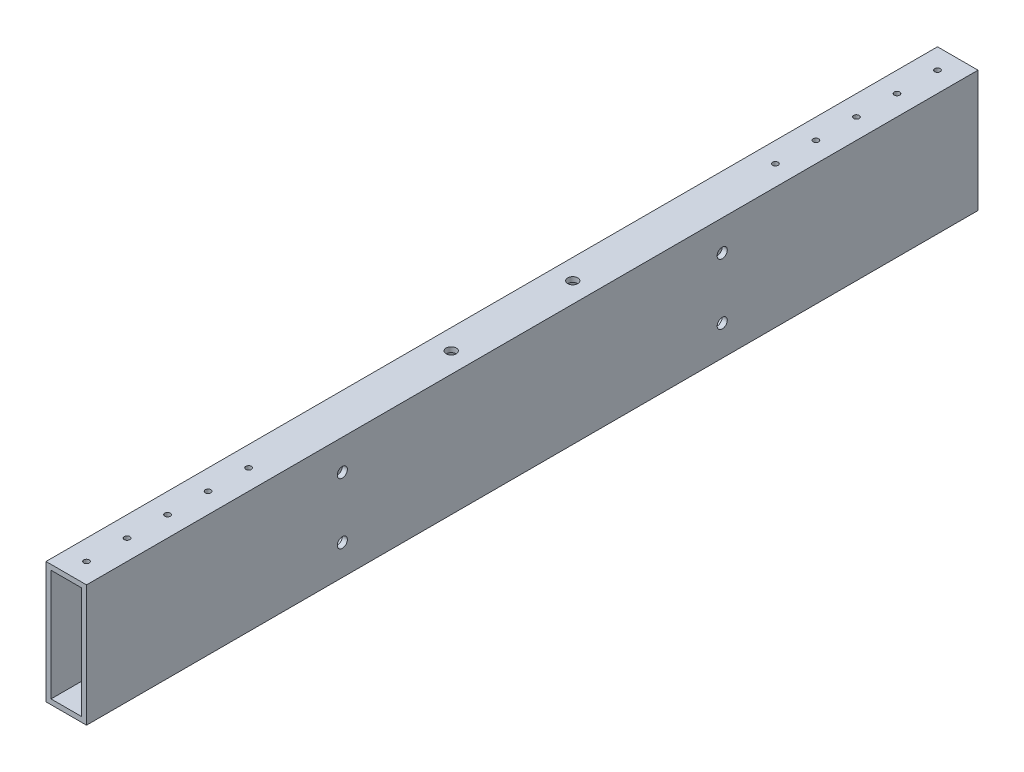
from build123d import *

# Parameters (mm, degrees)
SKETCH1_W                       = 25.4
SKETCH1_H                       = 76.2
SKETCH1_W_2                     = 19.05
SKETCH1_H_2                     = 69.85
BOSS_EXTRUDE1_DEPTH             = 279.4
SKETCH3_R                       = 1.7272
CUT_EXTRUDE2_DEPTH              = 6.35
F_1_4_0_25_DIAMETER_HOLE1_D     = 6.35
F_1_4_0_25_DIAMETER_HOLE1_DEPTH = 25.4
F_1_4_0_25_DIAMETER_HOLE1_TIP   = 1.907732465
F_1_4_0_25_DIAMETER_HOLE2_D     = 6.35
SKETCH2_R                       = 1.7272
CUT_EXTRUDE4_DEPTH              = 6.35


with BuildPart() as part:
    # Sketch1 → Boss-Extrude1 (new, symmetric)
    with BuildSketch(Plane.XY):
        Rectangle(SKETCH1_W, SKETCH1_H)
        Rectangle(SKETCH1_W_2, SKETCH1_H_2, mode=Mode.SUBTRACT)
    extrude(amount=BOSS_EXTRUDE1_DEPTH, both=True)

    # Sketch3 → Cut-Extrude2 (cut)
    with BuildSketch(Plane.XZ.offset(38.1)):
        with Locations((0, 254)):
            Circle(SKETCH3_R)
        with Locations((0, 203.2)):
            Circle(SKETCH3_R)
        with Locations((0, 152.4)):
            Circle(SKETCH3_R)
        with Locations((0, 101.6)):
            Circle(SKETCH3_R)
        with Locations((0, 50.8)):
            Circle(SKETCH3_R)
        Circle(SKETCH3_R)
        with Locations((0, -50.8)):
            Circle(SKETCH3_R)
        with Locations((0, -101.6)):
            Circle(SKETCH3_R)
        with Locations((0, -152.4)):
            Circle(SKETCH3_R)
        with Locations((0, -203.2)):
            Circle(SKETCH3_R)
        with Locations((0, -254)):
            Circle(SKETCH3_R)
    extrude(amount=-CUT_EXTRUDE2_DEPTH, mode=Mode.SUBTRACT)

    # 1/4 (0.25) Diameter Hole1
    with Locations(Plane.ZY.offset(12.7)):
        with Locations((-119.0625, -19.05), (119.0625, -19.05), (-119.0625, 19.05), (119.0625, 19.05)):
            Hole(F_1_4_0_25_DIAMETER_HOLE1_D / 2, depth=F_1_4_0_25_DIAMETER_HOLE1_DEPTH)
            with Locations((0, 0, -(F_1_4_0_25_DIAMETER_HOLE1_DEPTH + F_1_4_0_25_DIAMETER_HOLE1_TIP / 2))):  # 118° drill point
                Cone(0, F_1_4_0_25_DIAMETER_HOLE1_D / 2, F_1_4_0_25_DIAMETER_HOLE1_TIP, mode=Mode.SUBTRACT)

    # 1/4 (0.25) Diameter Hole2 (through all)
    with Locations(Plane(origin=(0, 38.1, 0), x_dir=(1, 0, 0), z_dir=(0, 1, 0))):
        with Locations((0, -38.1), (0, 38.1)):
            Hole(F_1_4_0_25_DIAMETER_HOLE2_D / 2)

    # Sketch2 → Cut-Extrude4 (cut)
    with BuildSketch(Plane(origin=(0, 38.1, 0), x_dir=(1, 0, 0), z_dir=(0, 1, 0))):
        with Locations((0, 266.7)):
            Circle(SKETCH2_R)
        with Locations((0, 241.3)):
            Circle(SKETCH2_R)
        with Locations((0, 215.9)):
            Circle(SKETCH2_R)
        with Locations((0, 190.5)):
            Circle(SKETCH2_R)
        with Locations((0, 165.1)):
            Circle(SKETCH2_R)
    cut_extrude4 = extrude(amount=-CUT_EXTRUDE4_DEPTH, mode=Mode.SUBTRACT)

    # Mirror1: Cut-Extrude4 across plane
    add(cut_extrude4.mirror(Plane.XY), mode=Mode.SUBTRACT)


solid = part.part
